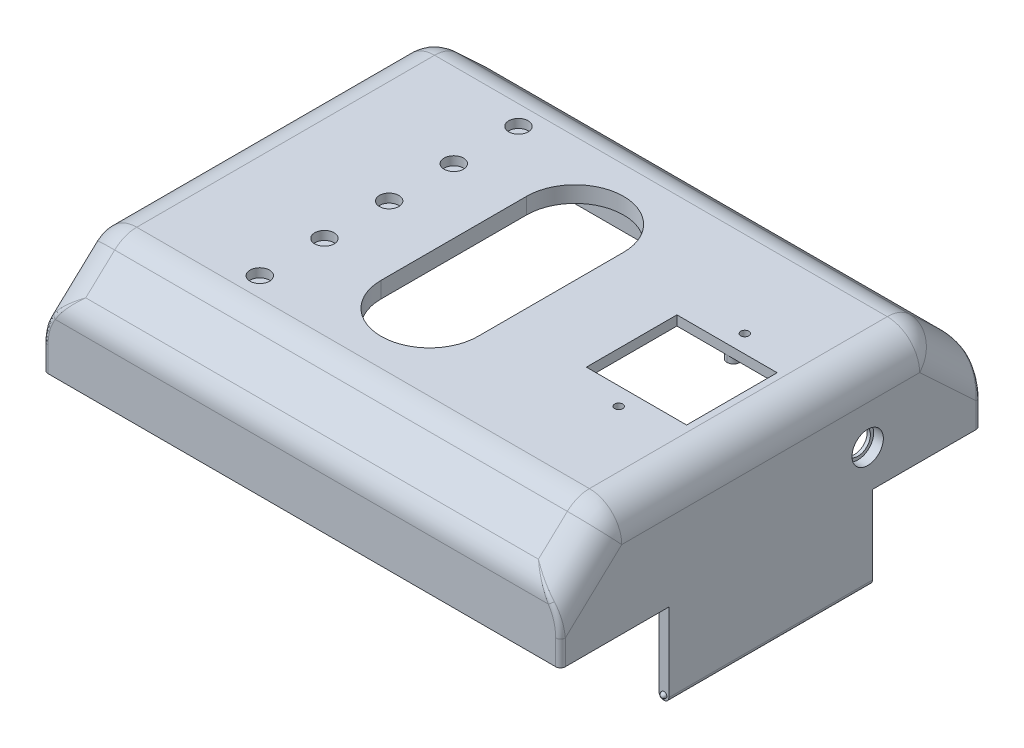
from build123d import *

# Parameters (mm, degrees)
SKETCH2_W           = 160
SKETCH2_H           = 130
BOSS_EXTRUDE1_DEPTH = 5
SKETCH4_W           = 3
SKETCH4_H           = 63
BOSS_EXTRUDE2_DEPTH = 25.75
BOSS_EXTRUDE5_DEPTH = 160
CUT_EXTRUDE9_DEPTH  = 20
SKETCH17_W          = 152
SKETCH17_H          = 100
CUT_EXTRUDE10_DEPTH = 9
FILLET3_R           = 10
SKETCH21_R          = 4.85
CUT_EXTRUDE12_DEPTH = 177.014203972
CUT_EXTRUDE13_DEPTH = 10
SKETCH30_R          = 3
CUT_EXTRUDE14_DEPTH = 2.7
SKETCH32_R          = 3
CUT_EXTRUDE15_DEPTH = 2.7
SKETCH33_W          = 31
SKETCH33_H          = 28
CUT_EXTRUDE16_DEPTH = 117.715733729
CUT_EXTRUDE17_DEPTH = 2
SKETCH39_R          = 1.25
CUT_EXTRUDE18_DEPTH = 117.715733729
BOSS_EXTRUDE6_START = -1
SKETCH40_R          = 4.85
BOSS_EXTRUDE6_DEPTH = 1
SKETCH43_R          = 4.85
BOSS_EXTRUDE8_DEPTH = 1
SKETCH44_R          = 3.85
CUT_EXTRUDE22_DEPTH = 173.386194343
SKETCH45_R          = 3.85
CUT_EXTRUDE23_DEPTH = 174.291661657
FILLET4_R           = 8
FILLET5_R           = 5
FILLET7_R           = 5
FILLET9_R           = 2
FILLET11_R          = 2
FILLET12_R          = 1.5
FILLET13_R          = 1.5


with BuildPart() as part:
    # Sketch2 → Boss-Extrude1 (new body)
    with BuildSketch(Plane(origin=(0, 0, 0), x_dir=(1, 0, 0), z_dir=(0, 1, 0))):
        Rectangle(SKETCH2_W, SKETCH2_H)
    extrude(amount=BOSS_EXTRUDE1_DEPTH)

    # Sketch4 → Boss-Extrude2 (add)
    with BuildSketch(Plane.XZ):
        with Locations((78.5, 0)):
            Rectangle(SKETCH4_W, SKETCH4_H)
    extrude(amount=BOSS_EXTRUDE2_DEPTH)

    # Sketch15 → Boss-Extrude5 (add)
    with BuildSketch(Plane.ZY.offset(80)):
        Polygon((-65, 0), (-65, 20), (-50, 34), (50, 34), (65, 20), (65, 0), align=None)
    extrude(amount=-BOSS_EXTRUDE5_DEPTH)

    # Sketch16 → Cut-Extrude9 (cut)
    with BuildSketch(Plane.XZ):
        Polygon((-76, 62), (76, 62), (76, -62), (-63, -62), (-62.822580645, -51.25), (-76, -51.25), align=None)
    extrude(amount=-CUT_EXTRUDE9_DEPTH, mode=Mode.SUBTRACT)

    # Sketch17 → Cut-Extrude10 (cut)
    with BuildSketch(Plane.XZ.offset(-20)):
        Rectangle(SKETCH17_W, SKETCH17_H)
    extrude(amount=-CUT_EXTRUDE10_DEPTH, mode=Mode.SUBTRACT)

    # Fillet3
    fillet3_edges = [part.edges().sort_by_distance(p)[0] for p in [
        (0, 20, 65),
        (-80, 27, 57.5),
        (-80, 34, 0),
        (-80, 27, -57.5),
        (80, 27, -57.5),
        (0, 20, -65),
        (80, 34, 0),
        (0, 34, -50),
        (80, 27, 57.5),
        (0, 34, 50),
    ]]
    fillet(fillet3_edges, radius=FILLET3_R)

    # Sketch21 → Cut-Extrude12 (cut, through all)
    with BuildSketch(Plane.ZY.offset(80)):
        with Locations((-30, 12)):
            Circle(SKETCH21_R)
    extrude(amount=-CUT_EXTRUDE12_DEPTH, mode=Mode.SUBTRACT)

    # Sketch29 → Cut-Extrude13 (cut)
    with BuildSketch(Plane(origin=(-13.246564753, 34, -3.538143019), x_dir=(1, 0, 0), z_dir=(0, 1, 0))):
        with BuildLine():
            Line((25.246564753, 18.961856981), (25.246564753, -26.038143019))
            ThreePointArc((25.246564753, -26.038143019), (10.246564753, -41.038143019), (-4.753435247, -26.038143019))
            Line((-4.753435247, -26.038143019), (-4.753435247, 18.961856981))
            ThreePointArc((-4.753435247, 18.961856981), (10.246564753, 33.961856981), (25.246564753, 18.961856981))
        make_face()
    extrude(amount=-CUT_EXTRUDE13_DEPTH, mode=Mode.SUBTRACT)

    # Sketch30 → Cut-Extrude14 (cut)
    with BuildSketch(Plane(origin=(0, 34, 0), x_dir=(1, 0, 0), z_dir=(0, 1, 0))):
        with Locations(Location((-38, -40, 0), (0, 0, 270))):
            Circle(SKETCH30_R)
        with Locations(Location((-38, -20, 0), (0, 0, 270))):
            Circle(SKETCH30_R)
        with Locations(Location((-38, 0, 0), (0, 0, 270))):
            Circle(SKETCH30_R)
        with Locations(Location((-38, 20, 0), (0, 0, 270))):
            Circle(SKETCH30_R)
        with Locations(Location((-38, 40, 0), (0, 0, 270))):
            Circle(SKETCH30_R)
    extrude(amount=-CUT_EXTRUDE14_DEPTH, mode=Mode.SUBTRACT)

    # Sketch32 → Cut-Extrude15 (cut)
    with BuildSketch(Plane.XZ):
        with Locations(Location((-72, -59.25, 0), (0, 0, 270))):
            Circle(SKETCH32_R)
    extrude(amount=-CUT_EXTRUDE15_DEPTH, mode=Mode.SUBTRACT)

    # Sketch33 → Cut-Extrude16 (cut, through all)
    with BuildSketch(Plane(origin=(0, 29, 0), x_dir=(1, 0, 0), z_dir=(0, 1, 0))):
        with Locations((52.5, 0)):
            Rectangle(SKETCH33_W, SKETCH33_H)
    extrude(amount=CUT_EXTRUDE16_DEPTH, mode=Mode.SUBTRACT)

    # Sketch37 → Cut-Extrude17 (cut)
    with BuildSketch(Plane.XZ.offset(-29)):
        Polygon((50.5, 21.5), (33, 21.5), (33, -21.5), (50.5, -21.5), (50.5, -14), (37, -14), (37, 14), (50.5, 14), align=None)
        Polygon((69, 21.5), (54.5, 21.5), (54.5, 14), (68, 14), (68, -14), (54.5, -14), (54.5, -21.5), (69, -21.5), align=None)
    extrude(amount=-CUT_EXTRUDE17_DEPTH, mode=Mode.SUBTRACT)

    # Sketch39 → Cut-Extrude18 (cut, through all)
    with BuildSketch(Plane.XZ.offset(-29)):
        with Locations(Location((52.5, 19.5, 0), (0, 0, 270))):
            Circle(SKETCH39_R)
        with Locations(Location((52.5, -19.5, 0), (0, 0, 270))):
            Circle(SKETCH39_R)
    extrude(amount=-CUT_EXTRUDE18_DEPTH, mode=Mode.SUBTRACT)

    # Sketch40 → Boss-Extrude6 (add)
    with BuildSketch(Plane(origin=(-76, 0, 0), x_dir=(0, 0, -1), z_dir=(1, 0, 0)).offset(BOSS_EXTRUDE6_START)):
        with Locations(Location((30, 12, 0), (0, 0, 180))):
            Circle(SKETCH40_R)
    extrude(amount=BOSS_EXTRUDE6_DEPTH)

    # Sketch45 → Cut-Extrude23 (cut, through all)
    with BuildSketch(Plane.ZY.offset(77)):
        with Locations((-30, 12)):
            Circle(SKETCH45_R)
    extrude(amount=-CUT_EXTRUDE23_DEPTH, mode=Mode.SUBTRACT)

    # Fillet4
    fillet4_edges = [part.edges().sort_by_distance(p)[0] for p in [
        (-62.822580645, 10, -51.25),
    ]]
    fillet(fillet4_edges, radius=FILLET4_R)

    # Fillet5
    fillet5_edges = [part.edges().sort_by_distance(p)[0] for p in [
        (-63, 10, -62),
        (-76, 10, -51.25),
        (76, 10, -62),
        (76, 10, 62),
        (-76, 10, 62),
    ]]
    fillet(fillet5_edges, radius=FILLET5_R)

    # Fillet7
    fillet7_edges = [part.edges().sort_by_distance(p)[0] for p in [
        (50.5, 30, -21.5),
        (33, 30, -21.5),
        (33, 30, 21.5),
        (50.5, 30, 21.5),
        (54.5, 30, 21.5),
        (69, 30, 21.5),
        (69, 30, -21.5),
        (54.5, 30, -21.5),
    ]]
    fillet(fillet7_edges, radius=FILLET7_R)

    # Fillet9
    fillet9_edges = [part.edges().sort_by_distance(p)[0] for p in [
        (50.5, 30, -14),
        (54.5, 30, -14),
        (54.5, 30, 14),
        (50.5, 30, 14),
    ]]
    fillet(fillet9_edges, radius=FILLET9_R - 0.0001)  # a hair under: the kernel refuses the full size

    # Fillet11
    fillet11_edges = [part.edges().sort_by_distance(p)[0] for p in [
        (0, 20, 50),
        (0.846405431, 20, -50),
    ]]
    fillet(fillet11_edges, radius=FILLET11_R)

    # Sketch47 → Revolve11 (revolve)
    with BuildSketch(Plane.XY.offset(31.5)):
        with BuildLine():
            Line((78.5, -23.35), (78.5, -25.15))
            ThreePointArc((78.5, -25.15), (79.4, -24.25), (78.5, -23.35))
        make_face()
    revolve11 = revolve(axis=Axis((78.5, -23.526690446, 31.5), (0, -1, 0)))

    # Mirror2: Revolve11 across plane
    add(revolve11.mirror(Plane.XY))

    # Fillet12
    fillet12_edges = [part.edges().sort_by_distance(p)[0] for p in [
        (80, -25.75, 0),
        (77, -25.75, 0),
    ]]
    fillet(fillet12_edges, radius=FILLET12_R - 0.0001)  # a hair under: the kernel refuses the full size

    # Fillet13
    fillet13_edges = [part.edges().sort_by_distance(p)[0] for p in [
        (-73.838182071, 19.786243083, 64.106509149),
        (-73.838182071, 19.786243083, -64.106509149),
        (73.838182071, 19.786243083, 64.106509149),
        (73.838182071, 19.786243083, -64.106509149),
        (80, 3.160571824, -65),
        (80, 3.160571824, 65),
        (-80, 3.160571824, 65),
        (-79.345051856, 11.190125948, 65),
        (79.345051856, 11.190125948, 65),
        (-80, 3.160571824, -65),
        (-79.345051856, 11.190125948, -65),
        (79.345051856, 11.190125948, -65),
    ]]
    fillet(fillet13_edges, radius=FILLET13_R)


with BuildPart() as body_2:
    # Sketch43 → Boss-Extrude8 (new body)
    with BuildSketch(Plane.ZY.offset(-76)):
        with Locations((-30, 12)):
            Circle(SKETCH43_R)
    extrude(amount=-BOSS_EXTRUDE8_DEPTH)

    # Sketch44 → Cut-Extrude22 (cut, through all)
    with BuildSketch(Plane.ZY.offset(-76)):
        with Locations((-30, 12)):
            Circle(SKETCH44_R)
    extrude(amount=-CUT_EXTRUDE22_DEPTH, mode=Mode.SUBTRACT)


solid = Compound([part.part, body_2.part])
